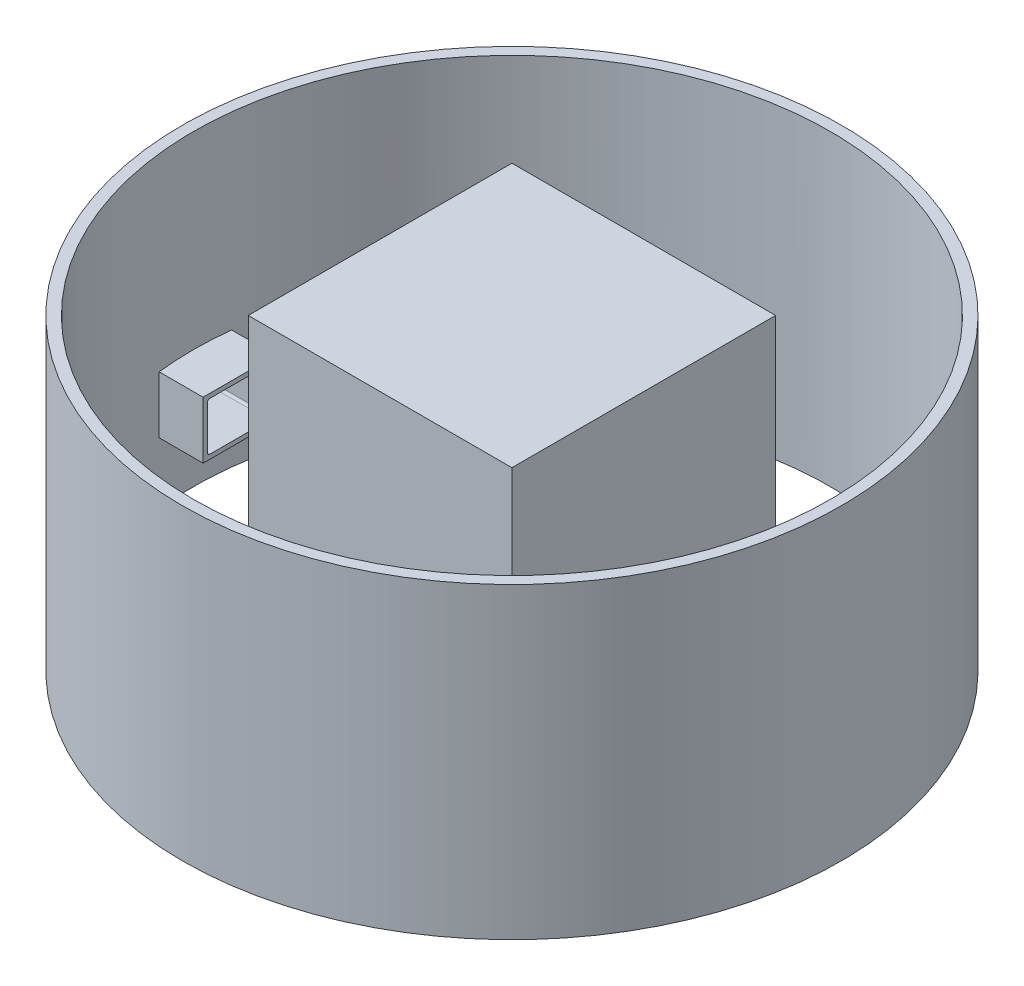
from build123d import *

# Parameters (mm, degrees)
CROQUIS1_R              = 75
CROQUIS1_R_2            = 72.5
SALIENTE_EXTRUIR1_DEPTH = 70
SALIENTE_EXTRUIR2_DEPTH = 10
CROQUIS3_W              = 30
CROQUIS3_H              = 30
SALIENTE_EXTRUIR3_DEPTH = 70
CROQUIS5_W              = 16.5
CROQUIS5_H              = 13
CROQUIS5_W_2            = 14.5
CROQUIS5_H_2            = 11
SALIENTE_EXTRUIR4_DEPTH = 65
CROQUIS6_W              = 14.5
CROQUIS6_H              = 11
CORTAR_EXTRUIR2_DEPTH   = 40
CROQUIS4_R              = 128
CROQUIS4_R_2            = 78
CORTAR_EXTRUIR3_DEPTH   = 140.821314541
REDONDEO1_R             = 0.5
CROQUIS8_W              = 32.029073991
CROQUIS8_H              = 16.5
CORTAR_EXTRUIR5_DEPTH   = 117.438825308


with BuildPart() as part:
    # Croquis1 → Saliente-Extruir1 (new body)
    with BuildSketch(Plane(origin=(0, 0, 0), x_dir=(1, 0, 0), z_dir=(0, 1, 0))):
        with Locations(Location((0, 0, 0), (0, 0, 270))):
            Circle(CROQUIS1_R)
        with Locations(Location((0, 0, 0), (0, 0, 270))):
            Circle(CROQUIS1_R_2, mode=Mode.SUBTRACT)
    extrude(amount=SALIENTE_EXTRUIR1_DEPTH)

    # Croquis2 → Saliente-Extruir2 (add)
    with BuildSketch(Plane(origin=(0, 0, 0), x_dir=(-1, 0, 0), z_dir=(0, -1, 0))):
        with BuildLine():
            Line((36.25, 62.786841774), (36.25, 45.915002995))
            ThreePointArc((36.25, 45.915002995), (41.365746699, 41.365746699), (45.915002995, 36.25))
            Line((45.915002995, 36.25), (62.786841774, 36.25))
            ThreePointArc((62.786841774, 36.25), (51.265241636, 51.265241636), (36.25, 62.786841774))
        make_face()
        with BuildLine():
            ThreePointArc((45.915002995, -36.25), (41.365746699, -41.365746699), (36.25, -45.915002995))
            Line((36.25, -45.915002995), (36.25, -62.786841774))
            ThreePointArc((36.25, -62.786841774), (51.265241636, -51.265241636), (62.786841774, -36.25))
            Line((62.786841774, -36.25), (45.915002995, -36.25))
        make_face()
        with BuildLine():
            Line((-36.25, -62.786841774), (-36.25, -45.915002995))
            ThreePointArc((-36.25, -45.915002995), (-41.365746699, -41.365746699), (-45.915002995, -36.25))
            Line((-45.915002995, -36.25), (-62.786841774, -36.25))
            ThreePointArc((-62.786841774, -36.25), (-51.265241636, -51.265241636), (-36.25, -62.786841774))
        make_face()
        with BuildLine():
            ThreePointArc((-45.915002995, 36.25), (-41.365746699, 41.365746699), (-36.25, 45.915002995))
            Line((-36.25, 45.915002995), (-36.25, 62.786841774))
            ThreePointArc((-36.25, 62.786841774), (-51.265241636, 51.265241636), (-62.786841774, 36.25))
            Line((-62.786841774, 36.25), (-45.915002995, 36.25))
        make_face()
    extrude(amount=-SALIENTE_EXTRUIR2_DEPTH)



with BuildPart() as body_2:
    # Croquis3 → Saliente-Extruir3 (new body)
    with BuildSketch(Plane(origin=(0, 70, 0), x_dir=(1, 0, 0), z_dir=(0, 1, 0))):
        with Locations((-15, 15)):
            Rectangle(CROQUIS3_W, CROQUIS3_H)
        with Locations((-15, -15)):
            Rectangle(CROQUIS3_W, CROQUIS3_H)
        with Locations((15, -15)):
            Rectangle(CROQUIS3_W, CROQUIS3_H)
        with Locations((15, 15)):
            Rectangle(CROQUIS3_W, CROQUIS3_H)
    extrude(amount=-SALIENTE_EXTRUIR3_DEPTH)


with BuildPart() as part_1:
    add(part.part)

    add(body_2.part)  # Saliente-Extruir4 merges body 2
    # Croquis5 → Saliente-Extruir4 (add)
    with BuildSketch(Plane.ZY.offset(30)):
        with Locations((0, 20.5)):
            Rectangle(CROQUIS5_W, CROQUIS5_H)
        with Locations((0, 20.5)):
            Rectangle(CROQUIS5_W_2, CROQUIS5_H_2, mode=Mode.SUBTRACT)
    extrude(amount=SALIENTE_EXTRUIR4_DEPTH)

    # Croquis6 → Cortar-Extruir2 (cut)
    with BuildSketch(Plane.ZY.offset(95)):
        with Locations((0, 20.5)):
            Rectangle(CROQUIS6_W, CROQUIS6_H)
    extrude(amount=-CORTAR_EXTRUIR2_DEPTH, mode=Mode.SUBTRACT)

    # Croquis4 → Cortar-Extruir3 (cut, through all)
    with BuildSketch(Plane(origin=(0, 0, 0), x_dir=(-1, 0, 0), z_dir=(0, -1, 0))):
        Circle(CROQUIS4_R)
        Circle(CROQUIS4_R_2, mode=Mode.SUBTRACT)
    extrude(amount=-CORTAR_EXTRUIR3_DEPTH, mode=Mode.SUBTRACT)

    # Redondeo1
    redondeo1_edges = [part_1.edges().sort_by_distance(p)[0] for p in [
        (-53.831164997, 26, 7.25),
        (-53.831164997, 15, 7.25),
        (-53.831164997, 15, -7.25),
        (-53.831164997, 26, -7.25),
    ]]
    fillet(redondeo1_edges, radius=REDONDEO1_R)
    redondeo1_2_edges = [part_1.edges().sort_by_distance(p)[0] for p in [
        (-76.053671929, 27, -8.25),
        (-76.053671929, 27, 8.25),
        (-78, 27, 0),
        (-76.053671929, 14, -8.25),
        (-76.053671929, 14, 8.25),
        (-77.562474819, 20.5, -8.25),
        (-78, 14, 0),
        (-77.562474819, 20.5, 8.25),
    ]]
    fillet(redondeo1_2_edges, radius=REDONDEO1_R)
    redondeo1_3_edges = [part_1.edges().sort_by_distance(p)[0] for p in [
        (-74.544869039, 20.5, 8.25),
        (-75, 14, 0),
        (-74.544869039, 20.5, -8.25),
        (-75, 27, 0),
        (-74.560078622, 26.845537275, 8.111391738),
        (-74.560078622, 26.845537275, -8.111391738),
        (-74.560079992, 14.154449566, -8.111379135),
        (-74.560078622, 14.154462725, 8.111391738),
    ]]
    fillet(redondeo1_3_edges, radius=REDONDEO1_R)
    redondeo1_4_edges = [part_1.edges().sort_by_distance(p)[0] for p in [
        (-78, 26, 0),
        (-77.662329993, 20.5, 7.25),
        (-77.662329993, 20.5, -7.25),
        (-78, 15, 0),
        (-77.675140377, 15.15451239, 7.111439183),
        (-77.675140553, 15.154510369, -7.111437264),
        (-77.675139485, 25.845477446, -7.111448934),
        (-77.675140377, 25.84548761, 7.111439183),
    ]]
    fillet(redondeo1_4_edges, radius=REDONDEO1_R - 0.0001)  # a hair under: the kernel refuses the full size

    # Croquis8 → Cortar-Extruir5 (cut, through all)
    with BuildSketch(Plane(origin=(0, 27, 0), x_dir=(1, 0, 0), z_dir=(0, 1, 0))):
        with Locations((-46.014536996, 0)):
            Rectangle(CROQUIS8_W, CROQUIS8_H)
    extrude(amount=-CORTAR_EXTRUIR5_DEPTH, mode=Mode.SUBTRACT)


with BuildPart() as cortar_extruir5_piece_1:
    # of the separate pieces the step leaves, piece 1, a body of its own (cortar_extruir5_pieces)
    add(part_1.part.solids().sort_by_distance((-30, 70, -30))[0])


with BuildPart() as cortar_extruir5_piece_2:
    # of the separate pieces the step leaves, piece 2, a body of its own (cortar_extruir5_pieces)
    add(part_1.part.solids().sort_by_distance((-77.703589489, 26.4999, -6.793539621))[0])


solid = Compound([cortar_extruir5_piece_1.part, cortar_extruir5_piece_2.part])
